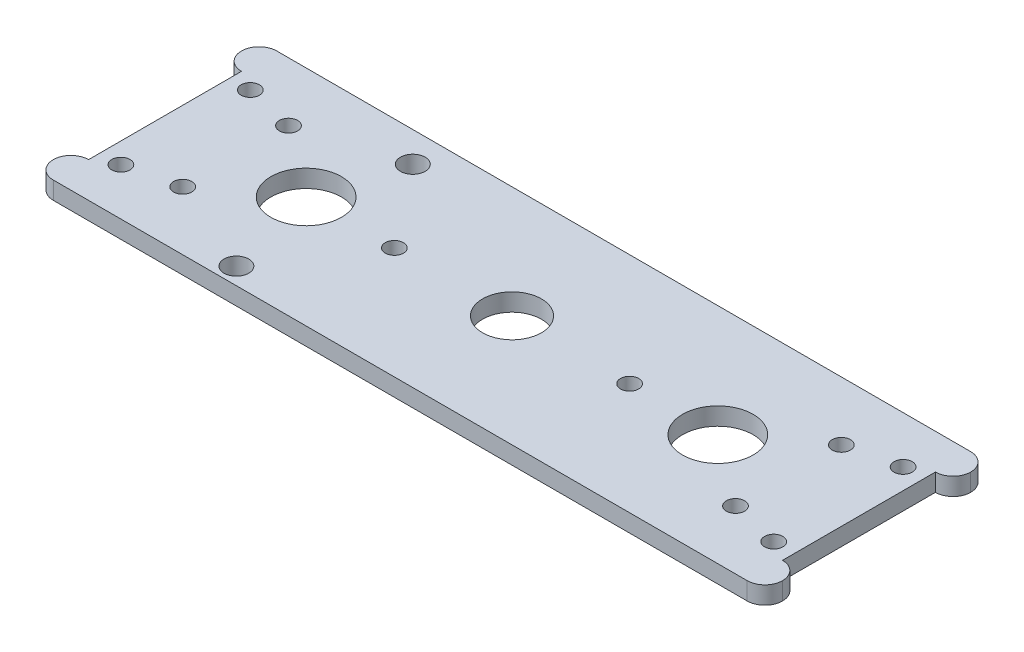
from build123d import *

# Parameters (mm, degrees)
SKETCH1_R           = 1.55
SKETCH1_R_2         = 5
SKETCH1_R_3         = 6
BOSS_EXTRUDE1_DEPTH = 3
FILLET1_R           = 3
SKETCH_3_R          = 2.1
CUT_EXTRUDE_1_DEPTH = 10


with BuildPart() as part:
    # Sketch1 → Boss-Extrude1 (new body)
    with BuildSketch(Plane(origin=(0, 0, 0), x_dir=(1, 0, 0), z_dir=(0, 1, 0))):
        Polygon((-62, 19), (62, 19), (62, 13), (59, 13), (59, -13), (62, -13), (62, -19), (-62, -19), (-62, -13), (-59, -13), (-59, 13), (-62, 13), align=None)
        with Locations(Location((55.5, 11, 0), (0, 0, 270))):
            Circle(SKETCH1_R, mode=Mode.SUBTRACT)
        with Locations(Location((-55.5, 11, 0), (0, 0, 90))):
            Circle(SKETCH1_R, mode=Mode.SUBTRACT)
        with Locations(Location((-55.5, -11, 0), (0, 0, 270))):
            Circle(SKETCH1_R, mode=Mode.SUBTRACT)
        with Locations(Location((55.5, -11, 0), (0, 0, 90))):
            Circle(SKETCH1_R, mode=Mode.SUBTRACT)
        with Locations(Location((0, 0, 0), (0, 0, 270))):
            Circle(SKETCH1_R_2, mode=Mode.SUBTRACT)
        with Locations(Location((20, 0, 0), (0, 0, 270))):
            Circle(SKETCH1_R, mode=Mode.SUBTRACT)
        with Locations(Location((-20, 0, 0), (0, 0, 90))):
            Circle(SKETCH1_R, mode=Mode.SUBTRACT)
        with Locations(Location((35, 0, 0), (0, 0, 270))):
            Circle(SKETCH1_R_3, mode=Mode.SUBTRACT)
        with Locations(Location((-35, 0, 0), (0, 0, 90))):
            Circle(SKETCH1_R_3, mode=Mode.SUBTRACT)
        with Locations(Location((47, 9, 0), (0, 0, 270))):
            Circle(SKETCH1_R, mode=Mode.SUBTRACT)
        with Locations(Location((47, -9, 0), (0, 0, 90))):
            Circle(SKETCH1_R, mode=Mode.SUBTRACT)
        with Locations(Location((-47, -9, 0), (0, 0, 270))):
            Circle(SKETCH1_R, mode=Mode.SUBTRACT)
        with Locations(Location((-47, 9, 0), (0, 0, 90))):
            Circle(SKETCH1_R, mode=Mode.SUBTRACT)
    extrude(amount=BOSS_EXTRUDE1_DEPTH)

    # Fillet1
    fillet1_edges = [part.edges().sort_by_distance(p)[0] for p in [
        (-62, 1.5, -19),
        (-62, 1.5, -13),
        (-62, 1.5, 13),
        (-62, 1.5, 19),
        (62, 1.5, 19),
        (62, 1.5, 13),
        (62, 1.5, -13),
        (62, 1.5, -19),
    ]]
    fillet(fillet1_edges, radius=FILLET1_R - 0.0001)  # a hair under: the kernel refuses the full size

    # 草图3 → 切除-拉伸1 (cut)
    with BuildSketch(Plane.XZ):
        with Locations(Location((-30.748546153, -13.88500521, 0), (0, 0, 270))):
            Circle(SKETCH_3_R)
        with Locations(Location((-30.748546153, 16.11499479, 0), (0, 0, 270))):
            Circle(SKETCH_3_R)
    extrude(amount=-CUT_EXTRUDE_1_DEPTH, mode=Mode.SUBTRACT)


solid = part.part
